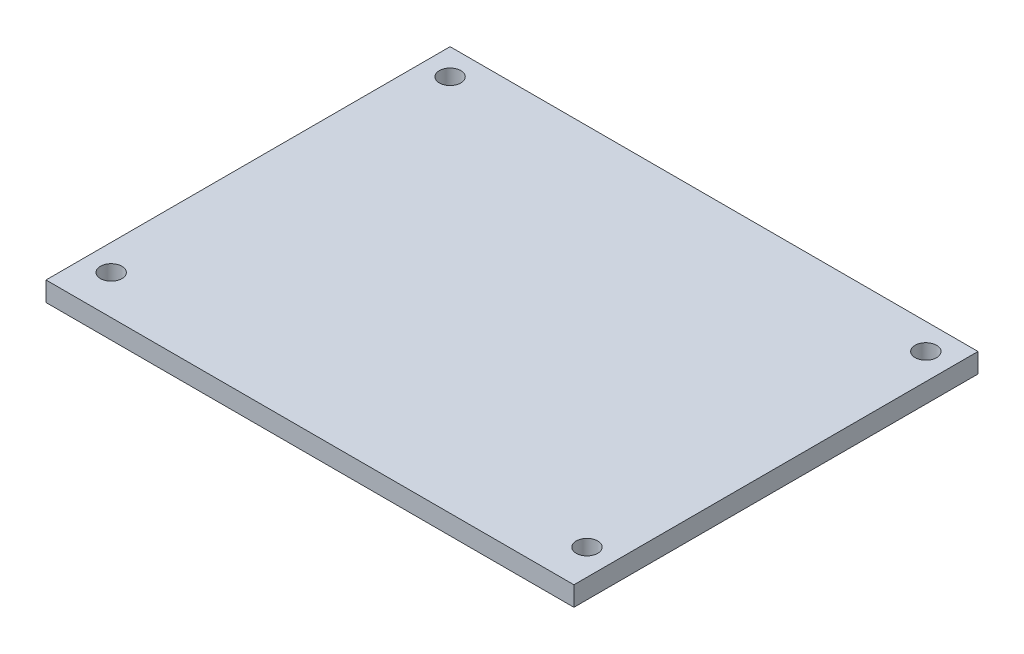
from build123d import *

# Parameters (mm, degrees)
SKETCH1_W      = 81
SKETCH1_H      = 62
EXTRUDE1_DEPTH = 3
SKETCH2_R      = 1.65
EXTRUDE2_DEPTH = 3
EXTRUDE3_START = -1
EXTRUDE3_DEPTH = 1


# Read off the part's stored shape, not the designer's step: Extrude3
with BuildPart() as part:
    # Sketch1 → Extrude1 (new body)
    with BuildSketch(Plane(origin=(0, 0, 0), x_dir=(1, 0, 0), z_dir=(0, 1, 0))):
        Rectangle(SKETCH1_W, SKETCH1_H)
    extrude(amount=EXTRUDE1_DEPTH)

    # Sketch2 → Extrude2 (cut)
    with BuildSketch(Plane(origin=(0, 3, 0), x_dir=(1, 0, 0), z_dir=(0, 1, 0))):
        with Locations(Location((-36.5, 27, 0), (0, 0, 270))):
            Circle(SKETCH2_R)
        with Locations(Location((36.5, 27, 0), (0, 0, 270))):
            Circle(SKETCH2_R)
        with Locations(Location((36.5, -25, 0), (0, 0, 270))):
            Circle(SKETCH2_R)
        with Locations(Location((-36.5, -25, 0), (0, 0, 270))):
            Circle(SKETCH2_R)
    extrude(amount=-EXTRUDE2_DEPTH, mode=Mode.SUBTRACT)

    # Extrude3 outline → Extrude3 (cut)
    # profile 1 of 3: a face of its own
    with BuildSketch(Plane(origin=(0, 0, 0), x_dir=(-1, 0, 0), z_dir=(0, -1, 0)).offset(EXTRUDE3_START)):
        with BuildLine():
            add(Edge.make_bspline(
                [(-20.83620317, 10.515533954), (-20.606406188, 10.512778879), (-20.151546203, 10.507325485), (-19.478673903, 10.45414753), (-18.823574892, 10.365498351), (-18.185797852, 10.244835095), (-17.562240045, 10.095078972), (-16.95766724, 9.899991553), (-16.368531887, 9.67692566), (-15.798549554, 9.420020141), (-15.250454982, 9.131638761), (-14.724418876, 8.814978055), (-14.224619684, 8.470430595), (-13.74754055, 8.100926736), (-13.301162201, 7.698649254), (-12.872810895, 7.274662991), (-12.477033305, 6.816755425), (-12.232729334, 6.494441517), (-12.110241632, 6.332841646)],
                knots=[0, 0, 0, 0, 0.068547537, 0.135682946, 0.20121499, 0.265682235, 0.329266835, 0.392395428, 0.455069762, 0.51712685, 0.578790035, 0.639739863, 0.700191504, 0.759806243, 0.819628319, 0.879354791, 0.939511608, 1, 1, 1, 1], degree=3))
            add(Edge.make_bspline(
                [(-31.597421119, 0.118899339), (-31.588534298, 0.478644788), (-31.571050034, 1.186421499), (-31.422502632, 2.225129804), (-31.183538082, 3.220280654), (-30.84412729, 4.170016338), (-30.413810997, 5.079332225), (-29.882230346, 5.941281967), (-29.255560962, 6.761377965), (-28.538717718, 7.527176544), (-27.752618659, 8.227401416), (-26.910796866, 8.843436866), (-26.014900026, 9.356108386), (-25.074798016, 9.784657885), (-24.083451264, 10.114054818), (-23.042974869, 10.344644456), (-21.955323928, 10.488170835), (-21.213252924, 10.50631488), (-20.83620317, 10.515533954)],
                knots=[0, 0, 0, 0, 0.064557846, 0.127013532, 0.18795481, 0.248013913, 0.307747682, 0.368234515, 0.429469844, 0.492743437, 0.556257769, 0.618216786, 0.679655476, 0.741245546, 0.803415265, 0.866815462, 0.932328312, 1, 1, 1, 1], degree=3))
            add(Edge.make_bspline(
                [(-29.061363426, -7.012510918), (-29.263852818, -6.763704124), (-29.666386971, -6.26909435), (-30.181390877, -5.467460171), (-30.62223405, -4.630498978), (-30.978667883, -3.753813671), (-31.257312072, -2.839371458), (-31.450347473, -1.886711375), (-31.575785213, -0.896723134), (-31.59012972, -0.223370056), (-31.597421119, 0.118899339)],
                knots=[0, 0, 0, 0, 0.12432851, 0.247156016, 0.368779749, 0.490733862, 0.613613772, 0.738957576, 0.867310575, 1, 1, 1, 1], degree=3))
            add(Edge.make_bspline(
                [(-20.812164709, -10.510107071), (-21.027271377, -10.508609971), (-21.452618178, -10.505649641), (-22.080611044, -10.457694398), (-22.691980077, -10.39226733), (-23.28497794, -10.293752296), (-23.862840654, -10.177498924), (-24.420329708, -10.021663172), (-24.96293091, -9.847096505), (-25.488464286, -9.641925153), (-25.997376856, -9.41040411), (-26.488027207, -9.148738059), (-26.960189678, -8.859127403), (-27.418506368, -8.547955915), (-27.856206846, -8.205228476), (-28.277084134, -7.83570485), (-28.683498284, -7.440630503), (-28.934942198, -7.155745627), (-29.061363426, -7.012510918)],
                knots=[0, 0, 0, 0, 0.069662801, 0.137749562, 0.203916744, 0.268779862, 0.332413706, 0.39475354, 0.456180032, 0.516995649, 0.577395938, 0.637198344, 0.696999184, 0.756756194, 0.816553905, 0.876947997, 0.938131788, 1, 1, 1, 1], degree=3))
            add(Edge.make_bspline(
                [(-12.110241632, -6.315395533), (-12.236630831, -6.478472401), (-12.488803832, -6.803845008), (-12.897135358, -7.262540493), (-13.327291343, -7.693992124), (-13.782466829, -8.094721388), (-14.257425638, -8.472746906), (-14.760695994, -8.817328799), (-15.285661894, -9.133276709), (-15.830544631, -9.422573421), (-16.394765275, -9.679243404), (-16.977647761, -9.89897922), (-17.576679621, -10.088264303), (-18.19188824, -10.243989655), (-18.824549708, -10.365538706), (-19.472380989, -10.446793991), (-20.136780275, -10.502462073), (-20.585016968, -10.507535878), (-20.812164709, -10.510107071)],
                knots=[0, 0, 0, 0, 0.061674239, 0.123053062, 0.183475001, 0.243726501, 0.304278917, 0.364862921, 0.425946204, 0.48739123, 0.549220384, 0.611143589, 0.67352853, 0.736961457, 0.800785283, 0.866012596, 0.932100748, 1, 1, 1, 1], degree=3))
            Line((-12.110241632, -6.315395533), (-13.680754452, -5.125491687))
            add(Edge.make_bspline(
                [(-20.824183939, -8.45882502), (-20.475025716, -8.44917485), (-19.787798808, -8.430181007), (-18.779981515, -8.269271012), (-17.815205711, -8.008368624), (-16.893419503, -7.64323764), (-16.017221524, -7.168578852), (-15.185240608, -6.593162409), (-14.396774491, -5.911514794), (-13.922652878, -5.391039775), (-13.680754452, -5.125491687)],
                knots=[0, 0, 0, 0, 0.12851519, 0.252948636, 0.374754734, 0.495939754, 0.617180641, 0.740909469, 0.867811148, 1, 1, 1, 1], degree=3))
            add(Edge.make_bspline(
                [(-29.802549324, -0.01731861), (-29.795338929, -0.312926152), (-29.781182276, -0.893312351), (-29.655191796, -1.743430126), (-29.463734131, -2.557833976), (-29.176787978, -3.331433075), (-28.822964831, -4.07376655), (-28.375875623, -4.772274283), (-27.858066838, -5.437511795), (-27.262213012, -6.053757211), (-26.608465493, -6.616692784), (-25.907048855, -7.112410392), (-25.159710068, -7.525638292), (-24.374700752, -7.869500844), (-23.545980101, -8.133825002), (-22.675038373, -8.319905708), (-21.763769829, -8.441289596), (-21.141087544, -8.452910671), (-20.824183939, -8.45882502)],
                knots=[0, 0, 0, 0, 0.064323217, 0.126290104, 0.186726469, 0.246146432, 0.305575643, 0.365429386, 0.426326309, 0.488839906, 0.551724972, 0.613918596, 0.675483766, 0.737333897, 0.800229044, 0.864502298, 0.931040739, 1, 1, 1, 1], degree=3))
            add(Edge.make_bspline(
                [(-20.948382657, 8.464251903), (-21.148858653, 8.461943546), (-21.54795004, 8.457348255), (-22.140227031, 8.396724682), (-22.721444466, 8.311517768), (-23.291224273, 8.185087349), (-23.848841179, 8.025243812), (-24.397940619, 7.834241447), (-24.930572618, 7.597928076), (-25.454105408, 7.336738019), (-25.955700899, 7.041724049), (-26.430301172, 6.719933467), (-26.876175275, 6.374967202), (-27.293675916, 6.005532308), (-27.683229906, 5.613292534), (-28.042014539, 5.194067725), (-28.368788312, 4.749198162), (-28.670028455, 4.284550119), (-28.939815503, 3.801477024), (-29.165700528, 3.298190907), (-29.365729798, 2.783310318), (-29.524011185, 2.25101797), (-29.649294138, 1.705059308), (-29.735737928, 1.143969092), (-29.795672049, 0.568919494), (-29.800244489, 0.179151993), (-29.802549324, -0.01731861)],
                knots=[0, 0, 0, 0, 0.043954909, 0.087501875, 0.130462627, 0.172752021, 0.215403067, 0.25764983, 0.300152749, 0.34312149, 0.385925163, 0.427685727, 0.46881795, 0.5094918, 0.549883031, 0.589980023, 0.63040523, 0.670868626, 0.711383944, 0.751627258, 0.791775577, 0.832458919, 0.873319045, 0.914542956, 0.956923558, 1, 1, 1, 1], degree=3))
            add(Edge.make_bspline(
                [(-13.680754452, 5.13091857), (-13.7927881, 5.264438397), (-14.015344939, 5.529677916), (-14.373397525, 5.902132455), (-14.74654977, 6.251076806), (-15.134659034, 6.578173261), (-15.544711145, 6.871983351), (-15.966772852, 7.147818225), (-16.407904539, 7.395062442), (-17.017914451, 7.694850934), (-17.815902156, 8.007686106), (-18.820444093, 8.269990285), (-19.869078942, 8.436968431), (-20.584493797, 8.45505324), (-20.948382657, 8.464251903)],
                knots=[0, 0, 0, 0, 0.063163259, 0.125474941, 0.18712122, 0.248294346, 0.309294856, 0.369850066, 0.430973376, 0.49245599, 0.616147966, 0.740843698, 0.868182649, 1, 1, 1, 1], degree=3))
            Line((-13.680754452, 5.13091857), (-12.110241632, 6.332841646))
        make_face()
    # profile 2 of 3: a face of its own
    with BuildSketch(Plane(origin=(0, 0, 0), x_dir=(-1, 0, 0), z_dir=(0, -1, 0)).offset(EXTRUDE3_START)):
        Polygon((13.017963497, -9.997286559), (14.812835291, -9.997286559), (14.812835291, 5.707841646), (27.993925035, -9.997286559), (28.402578881, -9.997286559), (28.402578881, 10.002713441), (26.607707086, 10.002713441), (26.607707086, -5.738472456), (13.394566061, 10.002713441), (13.017963497, 10.002713441), align=None)
    # profile 3 of 3: a face of its own
    with BuildSketch(Plane(origin=(0, 0, 0), x_dir=(-1, 0, 0), z_dir=(0, -1, 0)).offset(EXTRUDE3_START)):
        Polygon((7.477098112, -9.997286559), (9.428219907, -9.997286559), (0.197450676, 10.002713441), (-0.05895958, 10.002713441), (-9.546139067, -9.997286559), (-7.587004452, -9.997286559), (-4.546139067, -3.587030148), (4.520367343, -3.587030148), align=None)
        Polygon((0.049213497, 6.104476262), (3.574854522, -1.535748097), (-3.572581375, -1.535748097), align=None, mode=Mode.SUBTRACT)
    extrude(amount=EXTRUDE3_DEPTH, mode=Mode.SUBTRACT)


solid = part.part
